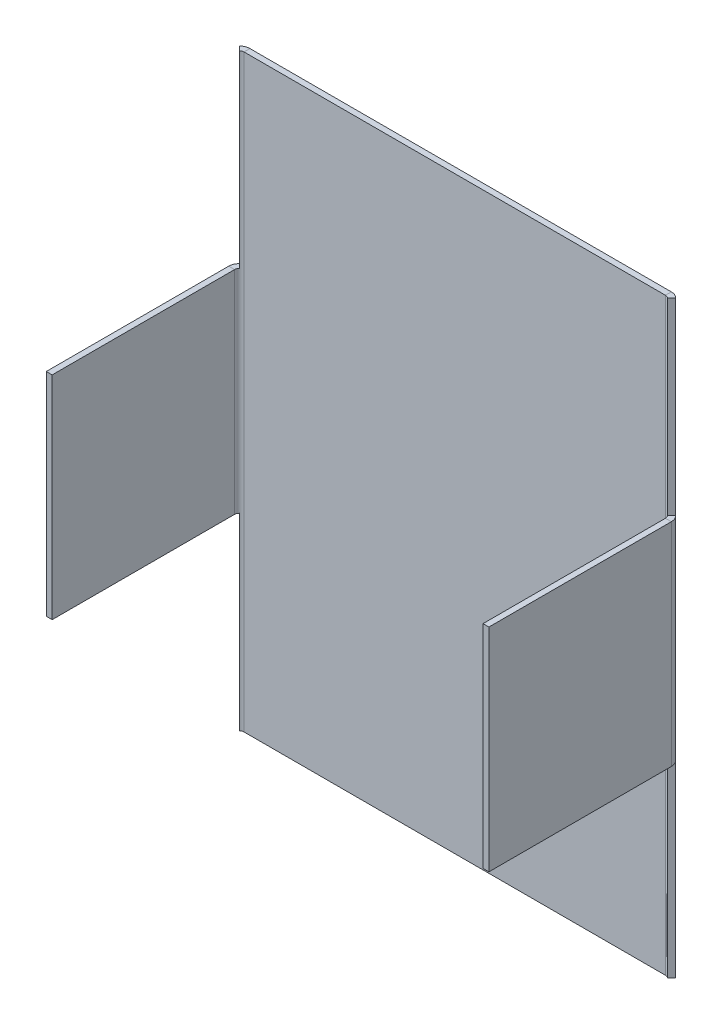
from build123d import *
from build123d.topology import SkipClean

# Parameters (mm, degrees)
BASE_FLANGE1_DEPTH     = 3.175
SKETCHED_START         = -76.863629597
SKETCHED_BEND1_DEPTH   = 317.5
SKETCHED_BEND1_2_DEPTH = 101.6
SKETCHED_START_2       = 139.036370403
SKETCHED_BEND1_3_DEPTH = 101.6
SKETCHED_START_3       = 24.736370403
SKETCHED_BEND1_4_DEPTH = 114.3
SKETCHED_BEND1_5_DEPTH = 317.5


# Read off the part's stored shape, not the designer's step: Sketched Bend1
# Sheet-metal steps are written as plain solids
with BuildPart() as part:
    # Sketch1 → Base-Flange1 (new body)
    with BuildSketch(Plane.XY):
        Polygon((-43.155335008, 139.036370403), (-144.755335008, 139.036370403), (-144.755335008, 240.636370403), (-378.435335008, 240.636370403), (-378.435335008, 139.036370403), (-480.035335008, 139.036370403), (-480.035335008, 24.736370403), (-378.435335008, 24.736370403), (-378.435335008, -76.863629597), (-144.755335008, -76.863629597), (-144.755335008, 24.736370403), (-43.155335008, 24.736370403), align=None)
    extrude(amount=-BASE_FLANGE1_DEPTH)

    # Sketched Bend1 outline → Sketched Bend1 (cut)
    with BuildSketch(Plane(origin=(0, 0, 0), x_dir=(1, 0, 0), z_dir=(0, 1, 0)).offset(SKETCHED_START)):
        with BuildLine():
            ThreePointArc((-380.313137759, 0), (-378.20567356, 2.316816086), (-375.193604089, 3.175))
            Line((-375.193604089, 3.175), (-480.035335008, 3.175))
            Line((-480.035335008, 3.175), (-480.035335008, 0))
            Line((-480.035335008, 0), (-380.313137759, 0))
        make_face()
        with BuildLine():
            ThreePointArc((-147.997065928, 3.175), (-144.984996457, 2.316816087), (-142.877532258, 0))
            Line((-142.877532258, 0), (-43.155335008, 0))
            Line((-43.155335008, 0), (-43.155335008, 3.175))
            Line((-43.155335008, 3.175), (-147.997065928, 3.175))
        make_face()
    extrude(amount=SKETCHED_BEND1_DEPTH, mode=Mode.SUBTRACT)

    # Sketched Bend1 2 outline → Sketched Bend1 2 (cut)
    with BuildSketch(Plane(origin=(0, 0, 0), x_dir=(1, 0, 0), z_dir=(0, 1, 0)).offset(SKETCHED_START)):
        Polygon((-377.733604089, 0), (-378.435335008, 0.701730919), (-378.435335008, 0), align=None)
        Polygon((-144.755335008, 0.701730919), (-145.457065927, 0), (-144.755335008, 0), align=None)
    extrude(amount=SKETCHED_BEND1_2_DEPTH, mode=Mode.SUBTRACT)

    # Sketched Bend1 3 outline → Sketched Bend1 3 (cut)
    with BuildSketch(Plane(origin=(0, 0, 0), x_dir=(1, 0, 0), z_dir=(0, 1, 0)).offset(SKETCHED_START_2)):
        Polygon((-377.733604089, 0), (-378.435335008, 0.701730919), (-378.435335008, 0), align=None)
        Polygon((-144.755335008, 0.701730919), (-145.457065927, 0), (-144.755335008, 0), align=None)
    extrude(amount=SKETCHED_BEND1_3_DEPTH, mode=Mode.SUBTRACT)

    # Sketched Bend1 4 outline → Sketched Bend1 4 (add)
    with BuildSketch(Plane(origin=(0, 0, 0), x_dir=(1, 0, 0), z_dir=(0, 1, 0)).offset(SKETCHED_START_3)):
        with BuildLine():
            ThreePointArc((-380.313137759, 0), (-380.757746427, -1.235567159), (-380.908604089, -2.54))
            Line((-380.908604089, -2.54), (-380.908604089, -100.898269081))
            Line((-380.908604089, -100.898269081), (-377.733604089, -100.898269081))
            Line((-377.733604089, -100.898269081), (-377.733604089, -2.54))
            ThreePointArc((-377.733604089, -2.54), (-376.989655313, -0.743948776), (-375.193604089, 0))
            Line((-375.193604089, 0), (-380.313137759, 0))
        make_face()
        with BuildLine():
            ThreePointArc((-147.997065928, 0), (-146.201014704, -0.743948775), (-145.457065928, -2.54))
            Line((-145.457065928, -2.54), (-145.457065928, -100.898269081))
            Line((-145.457065928, -100.898269081), (-142.282065928, -100.898269081))
            Line((-142.282065928, -100.898269081), (-142.282065928, -2.54))
            ThreePointArc((-142.282065928, -2.54), (-142.43292359, -1.235567159), (-142.877532258, 0))
            Line((-142.877532258, 0), (-147.997065928, 0))
        make_face()
    extrude(amount=SKETCHED_BEND1_4_DEPTH)

    # Sketched Bend1 5 outline → Sketched Bend1 5 (add)
    with SkipClean():  # the faces are left unmerged after this step: merging them gives an invalid solid
        with BuildSketch(Plane(origin=(0, 0, 0), x_dir=(1, 0, 0), z_dir=(0, 1, 0)).offset(SKETCHED_START)):
            with BuildLine():
                ThreePointArc((-378.435335008, 2.166634216), (-378.850199632, 1.852099045), (-379.234719343, 1.501115254))
                Line((-379.234719343, 1.501115254), (-378.435335008, 0.701730919))
                Line((-378.435335008, 0.701730919), (-378.435335008, 2.166634216))
            make_face()
            with BuildLine():
                Line((-375.193604089, 0), (-377.733604089, 0))
                Line((-377.733604089, 0), (-376.989655313, -0.743948776))
                ThreePointArc((-376.989655313, -0.743948776), (-376.165620007, -0.193345988), (-375.193604089, 0))
            make_face()
            with BuildLine():
                Line((-145.457065927, 0), (-147.997065928, 0))
                ThreePointArc((-147.997065928, 0), (-147.025050009, -0.193345987), (-146.201014703, -0.743948776))
                Line((-146.201014703, -0.743948776), (-145.457065927, 0))
            make_face()
            with BuildLine():
                ThreePointArc((-143.955950673, 1.501115254), (-144.340470384, 1.852099046), (-144.755335008, 2.166634216))
                Line((-144.755335008, 2.166634216), (-144.755335008, 0.701730919))
                Line((-144.755335008, 0.701730919), (-143.955950673, 1.501115254))
            make_face()
        extrude(amount=SKETCHED_BEND1_5_DEPTH)


solid = part.part
